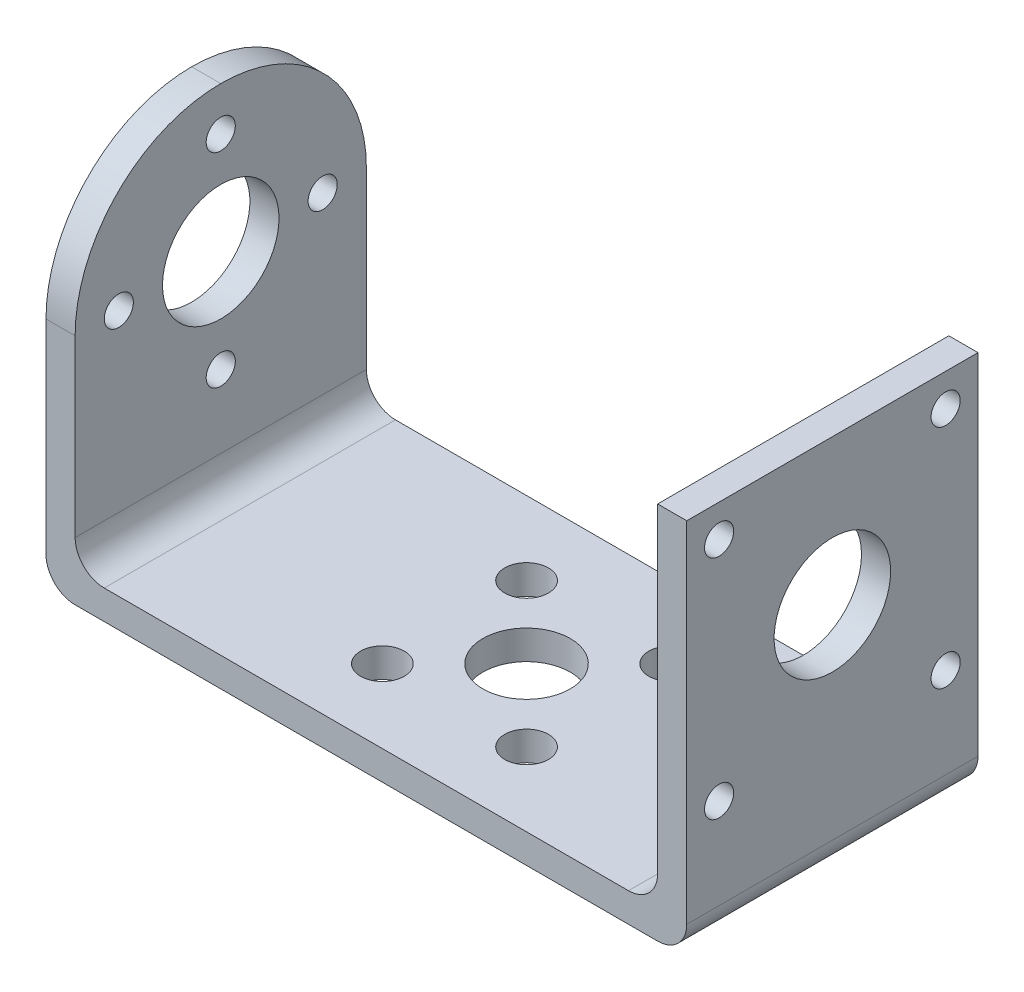
from build123d import *

# Parameters (mm, degrees)
EXTRUDE_1051_DEPTH     = 20
SKETCH2_R              = 4
SKETCH2_R_2            = 1
CUT_EXTRUDE_1_DEPTH    = 2
CUT_EXTRUDE_START      = -20
SKETCH3_R              = 1
SKETCH3_R_2            = 4
CUT_EXTRUDE_2_DEPTH    = 20
SKETCH4_R              = 3
SKETCH4_R_2            = 1.5
CUT_EXTRUDE_2789_DEPTH = 2
FILLET1_R              = 10
FILLET2_R              = 2


with BuildPart() as part:
    # Sketch1 → Extrude 1051 (new body)
    with BuildSketch(Plane.XY):
        Polygon((0, 0), (44, 0), (44, 26), (42, 26), (42, 2), (2, 2), (2, 26), (0, 26), align=None)
    extrude(amount=EXTRUDE_1051_DEPTH)

    # Sketch2 → Отверстия под ось и винты 1 (cut)
    with BuildSketch(Plane.ZY):
        with Locations((10, 16)):
            Circle(SKETCH2_R)
        with Locations((10, 23)):
            Circle(SKETCH2_R_2)
        with Locations((17, 16)):
            Circle(SKETCH2_R_2)
        with Locations((10, 9)):
            Circle(SKETCH2_R_2)
        with Locations((3, 16)):
            Circle(SKETCH2_R_2)
    extrude(amount=-CUT_EXTRUDE_1_DEPTH, mode=Mode.SUBTRACT)

    # Sketch3 → Отверстия под ось и винты 2 (cut)
    with BuildSketch(Plane(origin=(44, 0, 0), x_dir=(0, 0, -1), z_dir=(1, 0, 0)).offset(CUT_EXTRUDE_START)):
        with Locations((-17.778174593, 23.778174593)):
            Circle(SKETCH3_R)
        with Locations(Location((-10, 16, 0), (0, 0, 180))):
            Circle(SKETCH3_R_2)
        with Locations((-2.221825407, 23.778174593)):
            Circle(SKETCH3_R)
        with Locations((-2.221825407, 8.221825407)):
            Circle(SKETCH3_R)
        with Locations((-17.778174593, 8.221825407)):
            Circle(SKETCH3_R)
    extrude(amount=CUT_EXTRUDE_2_DEPTH, mode=Mode.SUBTRACT)

    # Sketch4 → Cut-Extrude 2789 (cut)
    with BuildSketch(Plane.XZ):
        with Locations(Location((23, 10, 0), (0, 0, 270))):
            Circle(SKETCH4_R)
        with Locations(Location((18.050252532, 5.050252532, 0), (0, 0, 270))):
            Circle(SKETCH4_R_2)
        with Locations(Location((27.949747468, 5.050252532, 0), (0, 0, 270))):
            Circle(SKETCH4_R_2)
        with Locations(Location((18.050252532, 14.949747468, 0), (0, 0, 270))):
            Circle(SKETCH4_R_2)
        with Locations(Location((27.949747468, 14.949747468, 0), (0, 0, 270))):
            Circle(SKETCH4_R_2)
    extrude(amount=-CUT_EXTRUDE_2789_DEPTH, mode=Mode.SUBTRACT)

    # Fillet1
    fillet1_edges = [part.edges().sort_by_distance(p)[0] for p in [
        (1, 26, 0),
        (1, 26, 20),
    ]]
    fillet(fillet1_edges, radius=FILLET1_R - 0.0001)  # a hair under: the kernel refuses the full size

    # Fillet2
    fillet2_edges = [part.edges().sort_by_distance(p)[0] for p in [
        (44, 0, 10),
        (0, 0, 10),
        (2, 2, 10),
        (42, 2, 10),
    ]]
    fillet(fillet2_edges, radius=FILLET2_R)


solid = part.part
